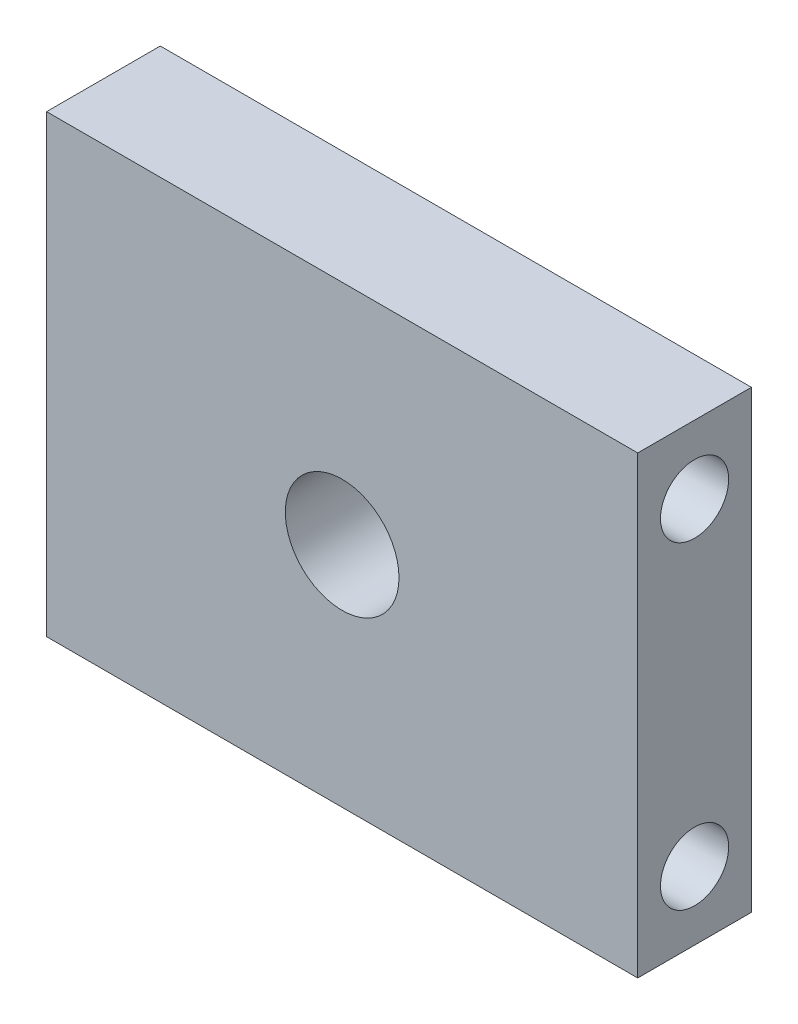
from build123d import *

# Parameters (mm, degrees)
SKETCH1_W           = 26
SKETCH1_H           = 20
BOSS_EXTRUDE1_DEPTH = 5
SKETCH2_R           = 2.5
CUT_EXTRUDE1_DEPTH  = 5
CUT_EXTRUDE2_REACH  = 30.302
SKETCH3_R           = 1.5


with BuildPart() as part:
    # Sketch1 → Boss-Extrude1 (new body)
    with BuildSketch(Plane.XY):
        Rectangle(SKETCH1_W, SKETCH1_H)
    extrude(amount=BOSS_EXTRUDE1_DEPTH)

    # Sketch2 → Cut-Extrude1 (cut)
    with BuildSketch(Plane.XY.offset(5)):
        Circle(SKETCH2_R)
    extrude(amount=-CUT_EXTRUDE1_DEPTH, mode=Mode.SUBTRACT)

    # Sketch3 → Cut-Extrude2 (cut, up to next)
    with BuildSketch(Plane.ZY.offset(13), mode=Mode.PRIVATE) as cut_extrude2_sk1:
        with Locations((2.5, 7)):
            Circle(SKETCH3_R)
    cut_extrude2_tool1 = extrude(cut_extrude2_sk1.sketch, amount=-CUT_EXTRUDE2_REACH, mode=Mode.PRIVATE) & part.part
    # Sketch3 → Cut-Extrude2 (cut, up to next)
    with BuildSketch(Plane.ZY.offset(13), mode=Mode.PRIVATE) as cut_extrude2_sk2:
        with Locations((2.5, -7)):
            Circle(SKETCH3_R)
    cut_extrude2_tool2 = extrude(cut_extrude2_sk2.sketch, amount=-CUT_EXTRUDE2_REACH, mode=Mode.PRIVATE) & part.part
    add(cut_extrude2_tool1.solids().sort_by_distance((-13, 7, 2.5))[0], mode=Mode.SUBTRACT)
    add(cut_extrude2_tool2.solids().sort_by_distance((-13, -7, 2.5))[0], mode=Mode.SUBTRACT)


solid = part.part
